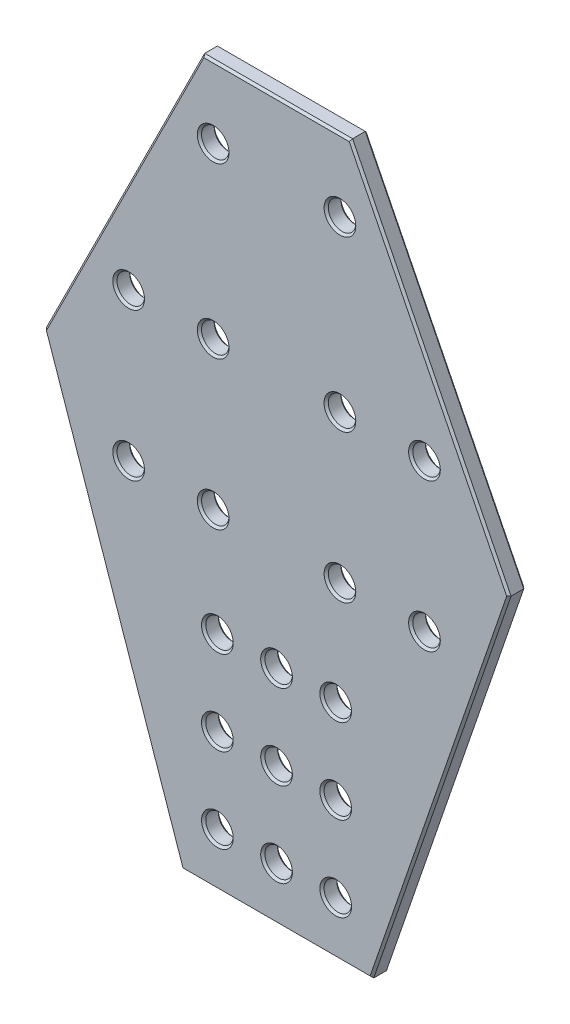
from build123d import *

# Parameters (mm, degrees)
SKETCH_1_R        = 13
EXTRUDE_924_DEPTH = 16
CHAMFER_1_SIZE    = 2


with BuildPart() as part:
    # 草图1 → Extrude 924 (new body)
    with BuildSketch(Plane.XY):
        Polygon((-70, 228), (70, 228), (220, -72), (90, -450), (-90, -450), (-220, -72), align=None)
        with Locations((-140, 0)):
            Circle(SKETCH_1_R, mode=Mode.SUBTRACT)
        with Locations((-60, 0)):
            Circle(SKETCH_1_R, mode=Mode.SUBTRACT)
        with Locations((60, -140)):
            Circle(SKETCH_1_R, mode=Mode.SUBTRACT)
        with Locations((140, -140)):
            Circle(SKETCH_1_R, mode=Mode.SUBTRACT)
        with Locations((-140, -140)):
            Circle(SKETCH_1_R, mode=Mode.SUBTRACT)
        with Locations((-60, -140)):
            Circle(SKETCH_1_R, mode=Mode.SUBTRACT)
        with Locations((60, 0)):
            Circle(SKETCH_1_R, mode=Mode.SUBTRACT)
        with Locations((140, 0)):
            Circle(SKETCH_1_R, mode=Mode.SUBTRACT)
        with Locations((0, -400)):
            Circle(SKETCH_1_R, mode=Mode.SUBTRACT)
        with Locations((0, -240)):
            Circle(SKETCH_1_R, mode=Mode.SUBTRACT)
        with Locations((60, 160)):
            Circle(SKETCH_1_R, mode=Mode.SUBTRACT)
        with Locations((0, -320)):
            Circle(SKETCH_1_R, mode=Mode.SUBTRACT)
        with Locations((-60, 160)):
            Circle(SKETCH_1_R, mode=Mode.SUBTRACT)
        with Locations((56, -240)):
            Circle(SKETCH_1_R, mode=Mode.SUBTRACT)
        with Locations((56, -320)):
            Circle(SKETCH_1_R, mode=Mode.SUBTRACT)
        with Locations((56, -400)):
            Circle(SKETCH_1_R, mode=Mode.SUBTRACT)
        with Locations((-56, -400)):
            Circle(SKETCH_1_R, mode=Mode.SUBTRACT)
        with Locations((-56, -320)):
            Circle(SKETCH_1_R, mode=Mode.SUBTRACT)
        with Locations((-56, -240)):
            Circle(SKETCH_1_R, mode=Mode.SUBTRACT)
    extrude(amount=EXTRUDE_924_DEPTH)

    # 倒角1
    chamfer_1_edges = [part.edges().sort_by_distance(p)[0] for p in [
        (-69, -240, 0),
        (-69, -400, 0),
        (43, -320, 0),
        (-73, 160, 0),
        (-13, -320, 0),
        (-13, -400, 0),
        (47, 0, 0),
        (-153, -140, 0),
        (47, -140, 0),
        (-153, 0, 0),
        (-155, -261, 0),
        (0, -450, 0),
        (155, -261, 0),
        (145, 78, 0),
        (0, 228, 0),
        (-145, 78, 0),
        (-73, 0, 0),
        (127, -140, 0),
        (-73, -140, 0),
        (127, 0, 0),
        (-13, -240, 0),
        (47, 160, 0),
        (43, -240, 0),
        (43, -400, 0),
        (-69, -320, 0),
        (-69, -240, 16),
        (-69, -400, 16),
        (43, -320, 16),
        (-73, 160, 16),
        (-13, -320, 16),
        (-13, -400, 16),
        (47, 0, 16),
        (-153, -140, 16),
        (47, -140, 16),
        (-153, 0, 16),
        (0, 228, 16),
        (145, 78, 16),
        (155, -261, 16),
        (0, -450, 16),
        (-155, -261, 16),
        (-145, 78, 16),
        (-73, 0, 16),
        (127, -140, 16),
        (-73, -140, 16),
        (127, 0, 16),
        (-13, -240, 16),
        (47, 160, 16),
        (43, -240, 16),
        (43, -400, 16),
        (-69, -320, 16),
    ]]
    chamfer(chamfer_1_edges, length=CHAMFER_1_SIZE)


solid = part.part
